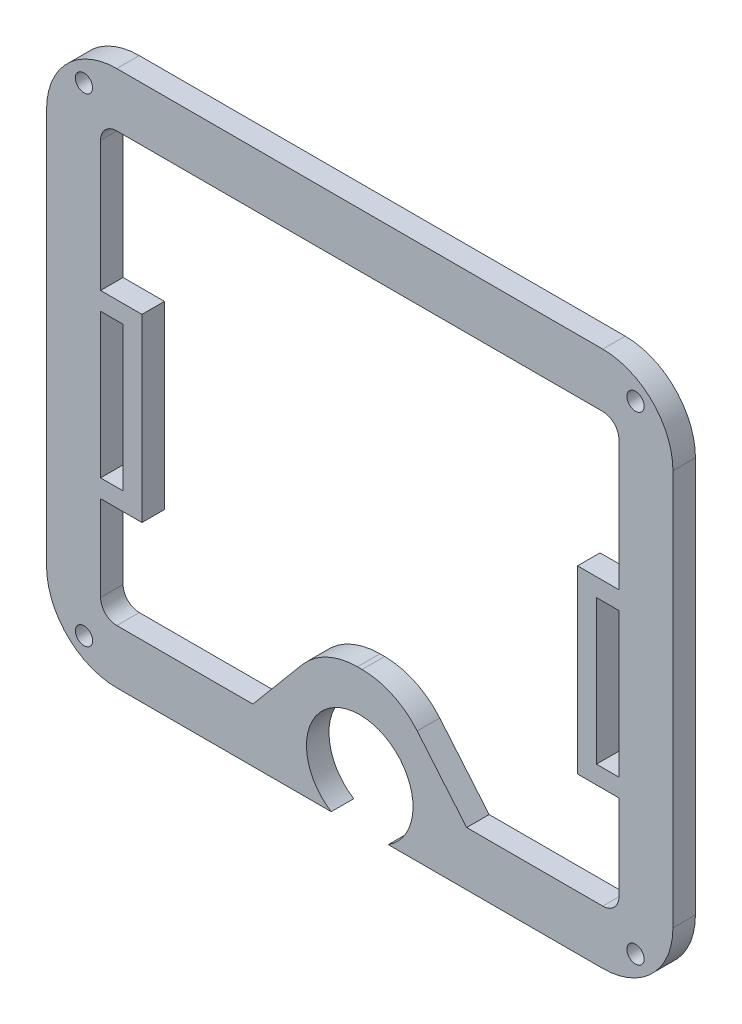
from build123d import *

# Parameters (mm, degrees)
SKETCH1_R           = 0.6096
BOSS_EXTRUDE1_DEPTH = 1.5875
SKETCH2_W           = 1.5875
SKETCH2_H           = 12.721913726
BOSS_EXTRUDE2_DEPTH = 2.921
CUT_EXTRUDE1_DEPTH  = 1.5875


with BuildPart() as part:
    # Sketch1 → Boss-Extrude1 (new body)
    with BuildSketch(Plane.XY):
        with BuildLine():
            Line((-17.145, -18.923), (-2.01269959, -18.923))
            ThreePointArc((-2.01269959, -18.923), (0, -11.9888), (2.01269959, -18.923))
            Line((2.01269959, -18.923), (17.145, -18.923))
            ThreePointArc((17.145, -18.923), (20.647299887, -17.472299887), (22.098, -13.97))
            Line((22.098, -13.97), (22.098, 13.97))
            ThreePointArc((22.098, 13.97), (20.647299887, 17.472299887), (17.145, 18.923))
            Line((17.145, 18.923), (-17.145, 18.923))
            ThreePointArc((-17.145, 18.923), (-20.647299887, 17.472299887), (-22.098, 13.97))
            Line((-22.098, 13.97), (-22.098, -13.97))
            ThreePointArc((-22.098, -13.97), (-20.647299887, -17.472299887), (-17.145, -18.923))
        make_face()
        with Locations((-19.457528855, 16.891)):
            Circle(SKETCH1_R, mode=Mode.SUBTRACT)
        with Locations((19.457528855, 16.891)):
            Circle(SKETCH1_R, mode=Mode.SUBTRACT)
        with Locations((19.457528855, -16.891)):
            Circle(SKETCH1_R, mode=Mode.SUBTRACT)
        with Locations((-19.457528855, -16.891)):
            Circle(SKETCH1_R, mode=Mode.SUBTRACT)
        with BuildLine():
            Line((-18.288, 13.97), (-18.288, -13.97))
            ThreePointArc((-18.288, -13.97), (-17.953223051, -14.778223051), (-17.145, -15.113))
            Line((-17.145, -15.113), (-7.542517063, -15.113))
            Line((-7.542517063, -15.113), (-4.056594232, -10.958638943))
            ThreePointArc((-4.056594232, -10.958638943), (-2.31198923, -9.619956442), (-0.165088461, -9.144))
            Line((-0.165088461, -9.144), (0.165088461, -9.144))
            ThreePointArc((0.165088461, -9.144), (2.31198923, -9.619956442), (4.056594232, -10.958638943))
            Line((4.056594232, -10.958638943), (7.542517063, -15.113))
            Line((7.542517063, -15.113), (17.145, -15.113))
            ThreePointArc((17.145, -15.113), (17.953223051, -14.778223051), (18.288, -13.97))
            Line((18.288, -13.97), (18.288, 13.97))
            ThreePointArc((18.288, 13.97), (17.953223051, 14.778223051), (17.145, 15.113))
            Line((17.145, 15.113), (-17.145, 15.113))
            ThreePointArc((-17.145, 15.113), (-17.953223051, 14.778223051), (-18.288, 13.97))
        make_face(mode=Mode.SUBTRACT)
    extrude(amount=BOSS_EXTRUDE1_DEPTH)

    # Sketch2 → Boss-Extrude2 (add)
    with BuildSketch(Plane(origin=(-18.288, 0, 0), x_dir=(0, 0, -1), z_dir=(1, 0, 0))):
        with Locations((-0.79375, -1.570800746)):
            Rectangle(SKETCH2_W, SKETCH2_H)
    boss_extrude2 = extrude(amount=BOSS_EXTRUDE2_DEPTH)

    # Sketch2<3> → Cut-Extrude1 (cut)
    with BuildSketch(Plane(origin=(-18.288, 0, 0), x_dir=(0, 0, -1), z_dir=(1, 0, 0))):
        Polygon((0, 1.615106112), (0, 3.520156117), (-1.5875, 3.520156117), (-1.5875, -6.644691549), (-1.5875, -6.661757609), (0, -6.661757609), align=None)
    cut_extrude1 = extrude(amount=CUT_EXTRUDE1_DEPTH, mode=Mode.SUBTRACT)

    # Mirror1: Boss-Extrude2, Cut-Extrude1 across plane
    add(boss_extrude2.mirror(Plane(origin=(0, 0, 0), x_dir=(0, 0, 1), z_dir=(1, 0, 0))))
    add(cut_extrude1.mirror(Plane(origin=(0, 0, 0), x_dir=(0, 0, 1), z_dir=(1, 0, 0))), mode=Mode.SUBTRACT)


solid = part.part
